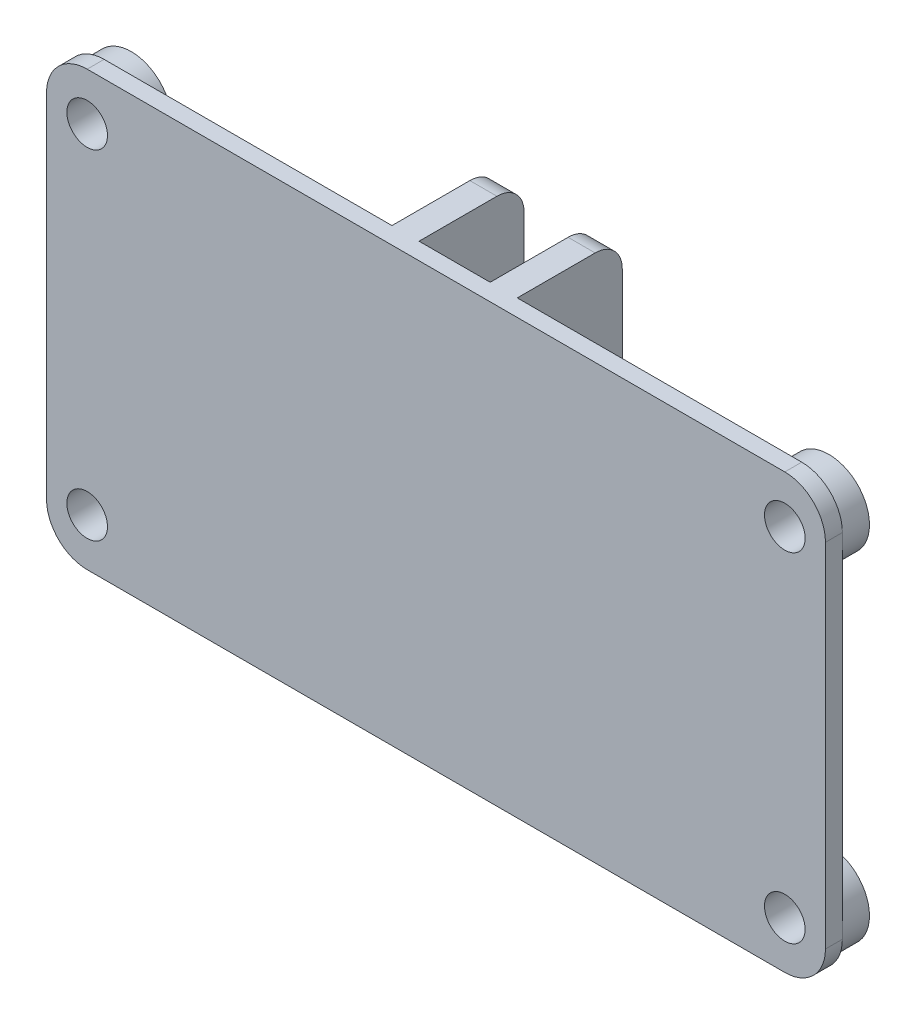
from build123d import *

# Parameters (mm, degrees)
ESQUISSE1_W                  = 57.5
ESQUISSE1_H                  = 32
BOSS_EXTRU_1_DEPTH           = 9
ESQUISSE2_W                  = 24.25
ESQUISSE2_H                  = 32
ESQUISSE2_W_2                = 24
ESQUISSE2_W_3                = 5.25
ENL_V_MAT_EXTRU_1_DEPTH      = 7.75
ESQUISSE3_R                  = 1.55
ENL_V_MAT_EXTRU_2_DEPTH      = 48.193749586
CONG_1_R                     = 3
CONG_2_R                     = 2
ESQUISSE10_R                 = 3
BOSS_EXTRU_2_DEPTH           = 2
ENL_V_MAT_EXTRU_3_DEPTH      = 67.259433291
ENL_V_MAT_EXTRU_3_DEPTH_BACK = 67.259433291
ESQUISSE9_R                  = 1.5


with BuildPart() as part:
    # Esquisse1 → Boss.-Extru.1 (new body)
    with BuildSketch(Plane.XY):
        with Locations((28.75, 16)):
            Rectangle(ESQUISSE1_W, ESQUISSE1_H)
    extrude(amount=BOSS_EXTRU_1_DEPTH)

    # Esquisse2 → Enlèv. mat.-Extru.1 (cut)
    with BuildSketch(Plane(origin=(0, 0, 0), x_dir=(-1, 0, 0), z_dir=(0, 0, -1))):
        with Locations((-12.125, 16)):
            Rectangle(ESQUISSE2_W, ESQUISSE2_H)
        with Locations((-45.5, 16)):
            Rectangle(ESQUISSE2_W_2, ESQUISSE2_H)
        with Locations((-28.875, 16)):
            Rectangle(ESQUISSE2_W_3, ESQUISSE2_H)
    extrude(amount=-ENL_V_MAT_EXTRU_1_DEPTH, mode=Mode.SUBTRACT)

    # Esquisse3 → Enlèv. mat.-Extru.2 (cut, through all)
    with BuildSketch(Plane(origin=(33.5, 0, 0), x_dir=(0, 0, -1), z_dir=(1, 0, 0))):
        with Locations((-3.5, 10)):
            Circle(ESQUISSE3_R)
        with Locations((-3.5, 20)):
            Circle(ESQUISSE3_R)
    extrude(amount=-ENL_V_MAT_EXTRU_2_DEPTH, mode=Mode.SUBTRACT)

    # Congé1
    cong_1_edges = [part.edges().sort_by_distance(p)[0] for p in [
        (0, 0, 8.375),
        (57.5, 0, 8.375),
        (0, 32, 8.375),
        (57.5, 32, 8.375),
    ]]
    fillet(cong_1_edges, radius=CONG_1_R)

    # Congé2
    cong_2_edges = [part.edges().sort_by_distance(p)[0] for p in [
        (25.25, 0, 0),
        (32.5, 0, 0),
        (25.25, 32, 0),
        (32.5, 32, 0),
    ]]
    fillet(cong_2_edges, radius=CONG_2_R)

    # Esquisse10 → Boss.-Extru.2 (add)
    with BuildSketch(Plane(origin=(0, 0, 7.75), x_dir=(-1, 0, 0), z_dir=(0, 0, -1))):
        with Locations((-54.5, 28.5)):
            Circle(ESQUISSE10_R)
        with Locations((-54.5, 3.5)):
            Circle(ESQUISSE10_R)
        with Locations((-3, 3.5)):
            Circle(ESQUISSE10_R)
        with Locations((-3, 28.5)):
            Circle(ESQUISSE10_R)
    extrude(amount=BOSS_EXTRU_2_DEPTH)

    # Esquisse9 → Enlèv. mat.-Extru.3 (cut, two sides: drawn at the far end of the back side and taken through both)
    with BuildSketch(Plane(origin=(0, 0, 7.75), x_dir=(-1, 0, 0), z_dir=(0, 0, -1)).offset(-ENL_V_MAT_EXTRU_3_DEPTH_BACK)):
        with Locations((-54.5, 28.5)):
            Circle(ESQUISSE9_R)
        with Locations((-3, 28.5)):
            Circle(ESQUISSE9_R)
        with Locations((-3, 3.5)):
            Circle(ESQUISSE9_R)
        with Locations((-54.5, 3.5)):
            Circle(ESQUISSE9_R)
    extrude(amount=ENL_V_MAT_EXTRU_3_DEPTH + ENL_V_MAT_EXTRU_3_DEPTH_BACK, mode=Mode.SUBTRACT)


solid = part.part
